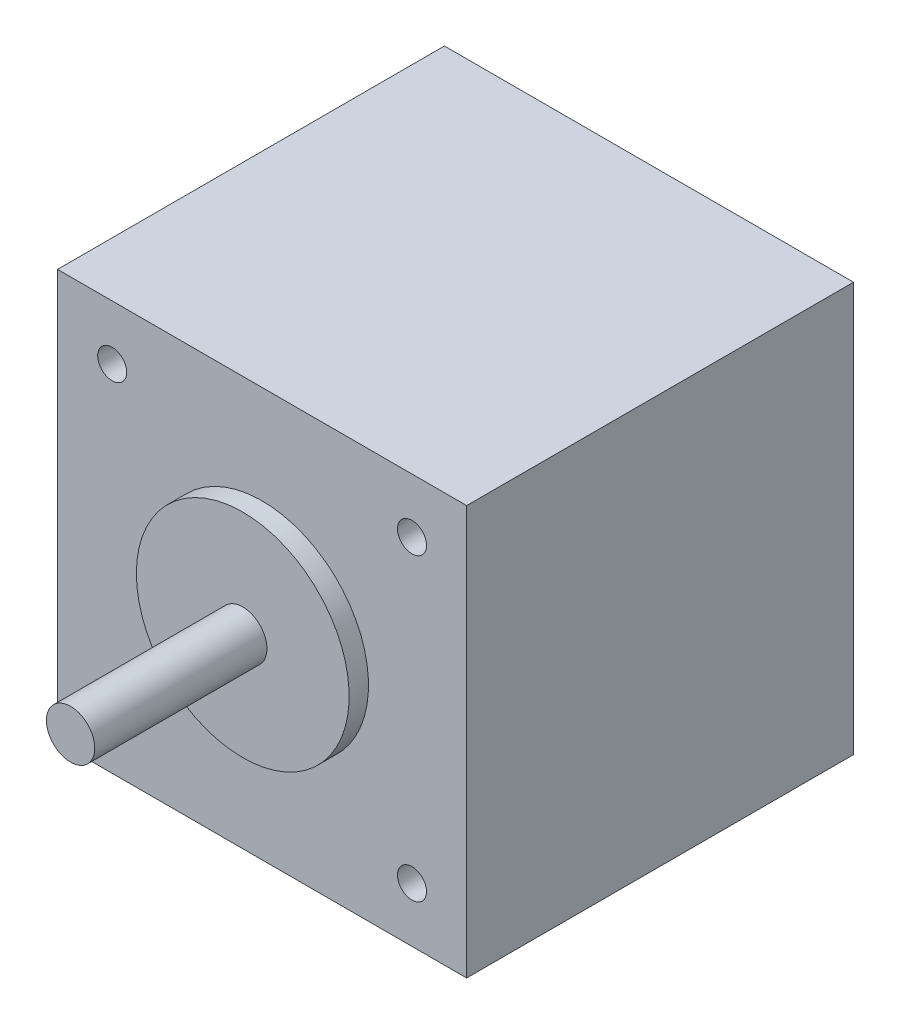
from build123d import *

# Parameters (mm, degrees)
SKETCH_1_W          = 42.3
SKETCH_1_H          = 42.3
EXTRUDE_1533_DEPTH  = 40
SKETCH_2_R          = 2.5
EXTRUDE_1588_DEPTH  = 59.8
SKETCH_3_R          = 11
EXTRUDE_1635_DEPTH  = 42
CUT_EXTRUDE_START   = 40
SKETCH_5_R          = 1.5
CUT_EXTRUDE_3_DEPTH = 4.5


with BuildPart() as part:
    # Эскиз1 → Extrude 1533 (new body)
    with BuildSketch(Plane.XY):
        Rectangle(SKETCH_1_W, SKETCH_1_H)
    extrude(amount=EXTRUDE_1533_DEPTH)

    # Эскиз2 → Extrude 1588 (add)
    with BuildSketch(Plane.XY):
        Circle(SKETCH_2_R)
    extrude(amount=EXTRUDE_1588_DEPTH)

    # Эскиз3 → Extrude 1635 (add)
    with BuildSketch(Plane.XY):
        Circle(SKETCH_3_R)
    extrude(amount=EXTRUDE_1635_DEPTH)

    # Эскиз5 → Крепеж_М3_ПРЕДВ (cut)
    with BuildSketch(Plane.XY.offset(CUT_EXTRUDE_START)):
        with Locations((-15.5, -15.5)):
            Circle(SKETCH_5_R)
        with Locations((-15.5, 15.5)):
            Circle(SKETCH_5_R)
        with Locations((15.5, -15.5)):
            Circle(SKETCH_5_R)
        with Locations((15.5, 15.5)):
            Circle(SKETCH_5_R)
    extrude(amount=-CUT_EXTRUDE_3_DEPTH, mode=Mode.SUBTRACT)


solid = part.part
